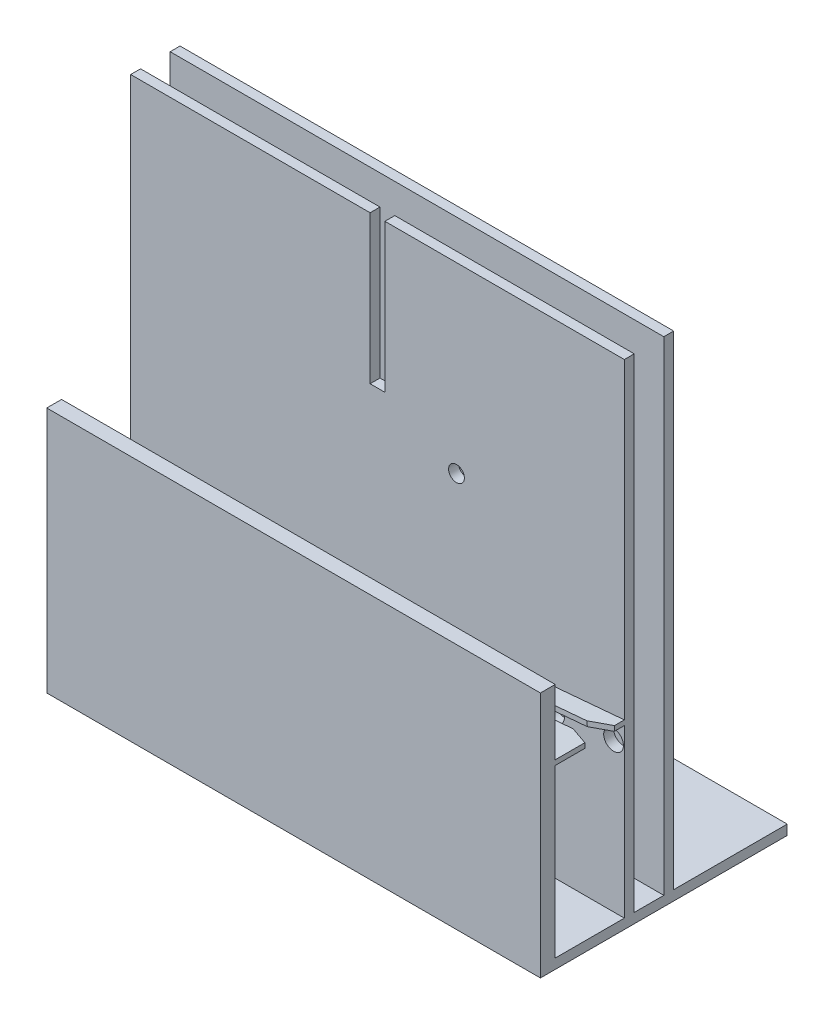
from build123d import *

# Parameters (mm, degrees)
SKETCH_MACHINE_CASE_W                      = 500
SKETCH_MACHINE_CASE_H                      = 250
MACHINE_CASE_DEPTH                         = 500
CUT_SHELL_START                            = 10
SKETCH_SHELL_W                             = 500
SKETCH_SHELL_H                             = 110
SKETCH_SHELL_H_2                           = 115
CUT_SHELL_DEPTH                            = 563.821961869
CUT_CAM_SHAFT_REACH                        = 574.822
SKETCH_CAM_SHAFT_R                         = 15
SKETCH_NUZZLE_FIXTURE_W                    = 500
SKETCH_NUZZLE_FIXTURE_H                    = 490
NUZZLE_FIXTURE_DEPTH                       = 10
SQUEEZING_SLOT_REACH                       = 584.859
SKETCH_SQUEEZING_SLOT_W                    = 15
SKETCH_SQUEEZING_SLOT_H                    = 150
CUT_CASE_TRIM_REACH                        = 614.372
SKETCH_CASE_TRIM_W                         = 500
SKETCH_CASE_TRIM_H                         = 250
CUT_ROLLING_WHEEL_SHAFT_HOLE_INSIDE_REACH  = 584.859
SKETCH_ROLLING_WHEEL_SHAFT_HOLE_INSIDE_R   = 10
CUT_ROLLING_START                          = -10
SKETCH_ROLLING_WHEEL_SHAFT_HOLE_OUTSIDE_R  = 10
CUT_ROLLING_WHEEL_SHAFT_HOLE_OUTSIDE_DEPTH = 10
LPATTERN_CONVEYOR_SLANT_COUNT              = 5
LPATTERN_CONVEYOR_SLANT_PITCH              = 60
LPATTERN_CONVEYOR_FLAT_COUNT               = 5
LPATTERN_CONVEYOR_FLAT_PITCH               = 55
POSITIONING_NOTCH_REACH                    = 584.859
CUT_NOTCH_REACH                            = 449.671
CUT_TOOTHPASTE_PATH_HOLD_REACH             = 574.822
SKETCH_TOOTHPASTE_PATH_HOLD_R              = 8
CUT_TOOTHPASTE_PATH_HOLD_DIRECTION_2_REACH = 574.822


with BuildPart() as part:
    # Sketch_Machine Case → Machine Case (new body)
    with BuildSketch(Plane(origin=(0, 0, 0), x_dir=(1, 0, 0), z_dir=(0, 1, 0))):
        Rectangle(SKETCH_MACHINE_CASE_W, SKETCH_MACHINE_CASE_H)
    extrude(amount=MACHINE_CASE_DEPTH)

    # Sketch_Shell → Cut_Shell (cut, through all)
    with BuildSketch(Plane(origin=(0, 0, 0), x_dir=(1, 0, 0), z_dir=(0, 1, 0)).offset(CUT_SHELL_START)):
        with Locations((0, -55)):
            Rectangle(SKETCH_SHELL_W, SKETCH_SHELL_H)
        with Locations((0, 67.5)):
            Rectangle(SKETCH_SHELL_W, SKETCH_SHELL_H_2)
    extrude(amount=CUT_SHELL_DEPTH, mode=Mode.SUBTRACT)

    # Sketch_Cam Shaft → Cut_Cam Shaft (cut, up to next)
    with BuildSketch(Plane.XY, mode=Mode.PRIVATE) as cut_cam_shaft_sk1:
        with Locations((0, 315)):
            Circle(SKETCH_CAM_SHAFT_R)
    cut_cam_shaft_tool1 = extrude(cut_cam_shaft_sk1.sketch, amount=-CUT_CAM_SHAFT_REACH, mode=Mode.PRIVATE) & part.part
    add(cut_cam_shaft_tool1.solids().sort_by_distance((0, 315, 0))[0], mode=Mode.SUBTRACT)

    # Sketch_Nuzzle Fixture → Nuzzle Fixture (add)
    with BuildSketch(Plane.XY.offset(40)):
        with Locations((0, 255)):
            Rectangle(SKETCH_NUZZLE_FIXTURE_W, SKETCH_NUZZLE_FIXTURE_H)
    extrude(amount=-NUZZLE_FIXTURE_DEPTH)

    # Sketch_Squeezing Slot → Squeezing Slot (cut, up to next)
    with BuildSketch(Plane.XY.offset(40), mode=Mode.PRIVATE) as squeezing_slot_sk1:
        with Locations((0, 425)):
            Rectangle(SKETCH_SQUEEZING_SLOT_W, SKETCH_SQUEEZING_SLOT_H)
    squeezing_slot_tool1 = extrude(squeezing_slot_sk1.sketch, amount=-SQUEEZING_SLOT_REACH, mode=Mode.PRIVATE) & part.part
    add(squeezing_slot_tool1.solids().sort_by_distance((0, 425, 40))[0], mode=Mode.SUBTRACT)

    # Sketch_Case Trim → Cut_Case Trim (cut, up to next)
    with BuildSketch(Plane.XY.offset(125), mode=Mode.PRIVATE) as cut_case_trim_sk1:
        with Locations((0, 375)):
            Rectangle(SKETCH_CASE_TRIM_W, SKETCH_CASE_TRIM_H)
    cut_case_trim_tool1 = extrude(cut_case_trim_sk1.sketch, amount=-CUT_CASE_TRIM_REACH, mode=Mode.PRIVATE) & part.part
    add(cut_case_trim_tool1.solids().sort_by_distance((0, 375, 125))[0], mode=Mode.SUBTRACT)

    # Sketch_Rolling Wheel Shaft Hole_Inside → Cut_Rolling Wheel Shaft Hole_Inside (cut, up to next)
    with BuildSketch(Plane.XY.offset(40), mode=Mode.PRIVATE) as cut_rolling_wheel_shaft_hole_inside_sk1:
        with Locations((0, 140)):
            Circle(SKETCH_ROLLING_WHEEL_SHAFT_HOLE_INSIDE_R)
    cut_rolling_wheel_shaft_hole_inside_tool1 = extrude(cut_rolling_wheel_shaft_hole_inside_sk1.sketch, amount=-CUT_ROLLING_WHEEL_SHAFT_HOLE_INSIDE_REACH, mode=Mode.PRIVATE) & part.part
    cut_rolling_wheel_shaft_hole_inside = cut_rolling_wheel_shaft_hole_inside_tool1.solids().sort_by_distance((0, 140, 40))[0]
    add(cut_rolling_wheel_shaft_hole_inside, mode=Mode.SUBTRACT)

    # Sketch_Rolling Wheel Shaft Hole_Outside → Cut_Rolling Wheel Shaft Hole_Outside (cut)
    with BuildSketch(Plane(origin=(0, 0, 110), x_dir=(-1, 0, 0), z_dir=(0, 0, -1)).offset(CUT_ROLLING_START)):
        with Locations((0, 140)):
            Circle(SKETCH_ROLLING_WHEEL_SHAFT_HOLE_OUTSIDE_R)
    cut_rolling_wheel_shaft_hole_outside = extrude(amount=CUT_ROLLING_WHEEL_SHAFT_HOLE_OUTSIDE_DEPTH, mode=Mode.SUBTRACT)

    # LPattern_Conveyor Slant: Cut_Rolling Wheel Shaft Hole_Inside, Cut_Rolling Wheel Shaft Hole_Outside ×5
    with Locations(*[Vector(0.9961946980917455, 0.08715574274765828, 0) * (i * LPATTERN_CONVEYOR_SLANT_PITCH) for i in range(1, LPATTERN_CONVEYOR_SLANT_COUNT)]):
        add(cut_rolling_wheel_shaft_hole_inside, mode=Mode.SUBTRACT)
        add(cut_rolling_wheel_shaft_hole_outside, mode=Mode.SUBTRACT)

    # LPattern_Conveyor Flat: Cut_Rolling Wheel Shaft Hole_Inside, Cut_Rolling Wheel Shaft Hole_Outside ×5
    with Locations(*[(-i * LPATTERN_CONVEYOR_FLAT_PITCH, 0, 0) for i in range(1, LPATTERN_CONVEYOR_FLAT_COUNT)]):
        add(cut_rolling_wheel_shaft_hole_inside, mode=Mode.SUBTRACT)
        add(cut_rolling_wheel_shaft_hole_outside, mode=Mode.SUBTRACT)

    # Sketch_Positioning Notch → Positioning Notch (add, up to next)
    with BuildSketch(Plane.XY.offset(40), mode=Mode.PRIVATE) as positioning_notch_sk1:
        Polygon((250, 178.910364257), (-0.436609429, 157), (-0.436609429, 162), (250, 183.910364257), align=None)
    positioning_notch_tool1 = extrude(positioning_notch_sk1.sketch, amount=POSITIONING_NOTCH_REACH, mode=Mode.PRIVATE) - part.part
    add(positioning_notch_tool1.solids().sort_by_distance((124.781695, 170.455182, 40))[0])

    # Sketch_Notch → Cut_Notch (cut, up to next)
    with BuildSketch(Plane(origin=(-14.06881893, 160.80733621, 0), x_dir=(0.9961946980917457, 0.08715574274765829, 0), z_dir=(-0.08715574274765829, 0.9961946980917457, 0)), mode=Mode.PRIVATE) as cut_notch_sk1:
        Polygon((13.684282327, -58), (245.077518919, -58), (265.077518919, -50), (265.077518919, -80), (245.077518919, -72), (13.684282327, -72), align=None)
    cut_notch_tool1 = extrude(cut_notch_sk1.sketch, amount=-CUT_NOTCH_REACH, mode=Mode.PRIVATE) & part.part
    add(cut_notch_tool1.solids().sort_by_distance((129.93791, 173.406293, 65))[0], mode=Mode.SUBTRACT)

    # Sketch_Toothpaste Path Hold → Cut_Toothpaste Path Hold (cut, up to next)
    with BuildSketch(Plane.XY, mode=Mode.PRIVATE) as cut_toothpaste_path_hold_sk1:
        with Locations((80, 315)):
            Circle(SKETCH_TOOTHPASTE_PATH_HOLD_R)
    cut_toothpaste_path_hold_tool1 = extrude(cut_toothpaste_path_hold_sk1.sketch, amount=-CUT_TOOTHPASTE_PATH_HOLD_REACH, mode=Mode.PRIVATE) & part.part
    add(cut_toothpaste_path_hold_tool1.solids().sort_by_distance((80, 315, 0))[0], mode=Mode.SUBTRACT)

    # Cut_Toothpaste Path Hold direction 2: up to this face of the body (flat: up to its plane)
    cut_toothpaste_path_hold_direction_2_end = Plane(part.part.faces().sort_by_distance((-0.717475715, 255.134461412, 40))[0])
    # Sketch_Toothpaste Path Hold → Cut_Toothpaste Path Hold direction 2 (cut, up to the picked face)
    with BuildSketch(Plane.XY, mode=Mode.PRIVATE) as cut_toothpaste_path_hold_direction_2_sk1:
        with Locations((80, 315)):
            Circle(SKETCH_TOOTHPASTE_PATH_HOLD_R)
    cut_toothpaste_path_hold_direction_2_tool1 = split(extrude(cut_toothpaste_path_hold_direction_2_sk1.sketch, amount=CUT_TOOTHPASTE_PATH_HOLD_DIRECTION_2_REACH, mode=Mode.PRIVATE), bisect_by=cut_toothpaste_path_hold_direction_2_end, keep=Keep.BOTH, mode=Mode.PRIVATE)
    add(cut_toothpaste_path_hold_direction_2_tool1.solids().sort_by(Axis((80, 315, 0), (0, 0, 1)))[0], mode=Mode.SUBTRACT)


solid = part.part
